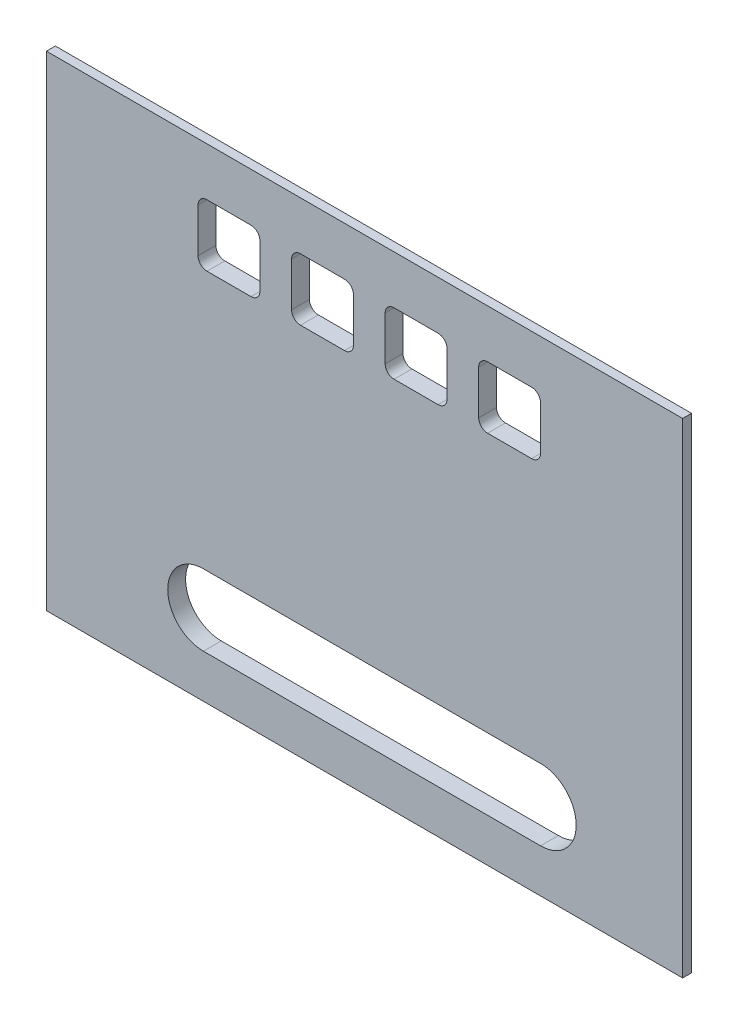
from build123d import *

# Parameters (mm, degrees)
SKETCH_1_W                                = 101
SKETCH_1_H                                = 74
EXTRUDE_1_DEPTH                           = 3
EXTRUDE_START                             = 1.5
SKETCH_2_W                                = 107
SKETCH_2_H                                = 80
EXTRUDE_2_DEPTH                           = 1.5
SKETCH_3_W                                = 10.4
SKETCH_3_H                                = 10.4
CUT_EXTRUDE_1_DEPTH                       = 5
SKETCH_4_W                                = 101
SKETCH_4_H                                = 1.5
TOP_REAR_INNER_EXTENSION_1P5MM_DEPTH      = 3
TOP_REAR_OUTER_SKIN_EXTENSION_1P5MM_START = 1.5
SKETCH_5_W                                = 107
SKETCH_5_H                                = 1.5
TOP_REAR_OUTER_SKIN_EXTENSION_1P5MM_DEPTH = 1.5
TOOL_D3_R1P5_BUTTON_CORNERS_R             = 1.5


with BuildPart() as part:
    # Эскиз1 → Бобышка-Вытянуть1 (new body)
    with BuildSketch(Plane.XY):
        with Locations((53.5, 40)):
            Rectangle(SKETCH_1_W, SKETCH_1_H)
    extrude(amount=EXTRUDE_1_DEPTH)

    # Эскиз2 → Бобышка-Вытянуть2 (add)
    with BuildSketch(Plane.XY.offset(EXTRUDE_START)):
        with Locations((53.5, 40)):
            Rectangle(SKETCH_2_W, SKETCH_2_H)
    extrude(amount=EXTRUDE_2_DEPTH)

    # Эскиз3 → Вырез-Вытянуть1 (cut)
    with BuildSketch(Plane.XY.offset(3)):
        with Locations((30.7, 68.15)):
            Rectangle(SKETCH_3_W, SKETCH_3_H)
        with Locations((46.433, 68.15)):
            Rectangle(SKETCH_3_W, SKETCH_3_H)
        with Locations((62.167, 68.15)):
            Rectangle(SKETCH_3_W, SKETCH_3_H)
        with Locations((77.9, 68.15)):
            Rectangle(SKETCH_3_W, SKETCH_3_H)
        with BuildLine():
            Line((26.4, 19.3), (83.1, 19.3))
            ThreePointArc((83.1, 19.3), (89.1, 13.3), (83.1, 7.3))
            Line((83.1, 7.3), (26.4, 7.3))
            ThreePointArc((26.4, 7.3), (20.4, 13.3), (26.4, 19.3))
        make_face()
    extrude(amount=-CUT_EXTRUDE_1_DEPTH, mode=Mode.SUBTRACT)

    # Эскиз4 → top_rear_inner_extension_1p5mm (add)
    with BuildSketch(Plane.XY):
        with Locations((53.5, 77.75)):
            Rectangle(SKETCH_4_W, SKETCH_4_H)
    extrude(amount=TOP_REAR_INNER_EXTENSION_1P5MM_DEPTH)

    # Эскиз5 → top_rear_outer_skin_extension_1p5mm (add)
    with BuildSketch(Plane.XY.offset(TOP_REAR_OUTER_SKIN_EXTENSION_1P5MM_START)):
        with Locations((53.5, 80.75)):
            Rectangle(SKETCH_5_W, SKETCH_5_H)
    extrude(amount=TOP_REAR_OUTER_SKIN_EXTENSION_1P5MM_DEPTH)

    # tool_D3_R1p5_button_corners
    tool_d3_r1p5_button_corners_edges = [part.edges().sort_by_distance(p)[0] for p in [
        (72.7, 73.35, 1.5),
        (83.1, 73.35, 1.5),
        (83.1, 62.95, 1.5),
        (72.7, 62.95, 1.5),
        (56.967, 73.35, 1.5),
        (67.367, 73.35, 1.5),
        (67.367, 62.95, 1.5),
        (56.967, 62.95, 1.5),
        (41.233, 73.35, 1.5),
        (51.633, 73.35, 1.5),
        (51.633, 62.95, 1.5),
        (41.233, 62.95, 1.5),
        (25.5, 62.95, 1.5),
        (35.9, 62.95, 1.5),
        (35.9, 73.35, 1.5),
        (25.5, 73.35, 1.5),
    ]]
    fillet(tool_d3_r1p5_button_corners_edges, radius=TOOL_D3_R1P5_BUTTON_CORNERS_R)


solid = part.part
